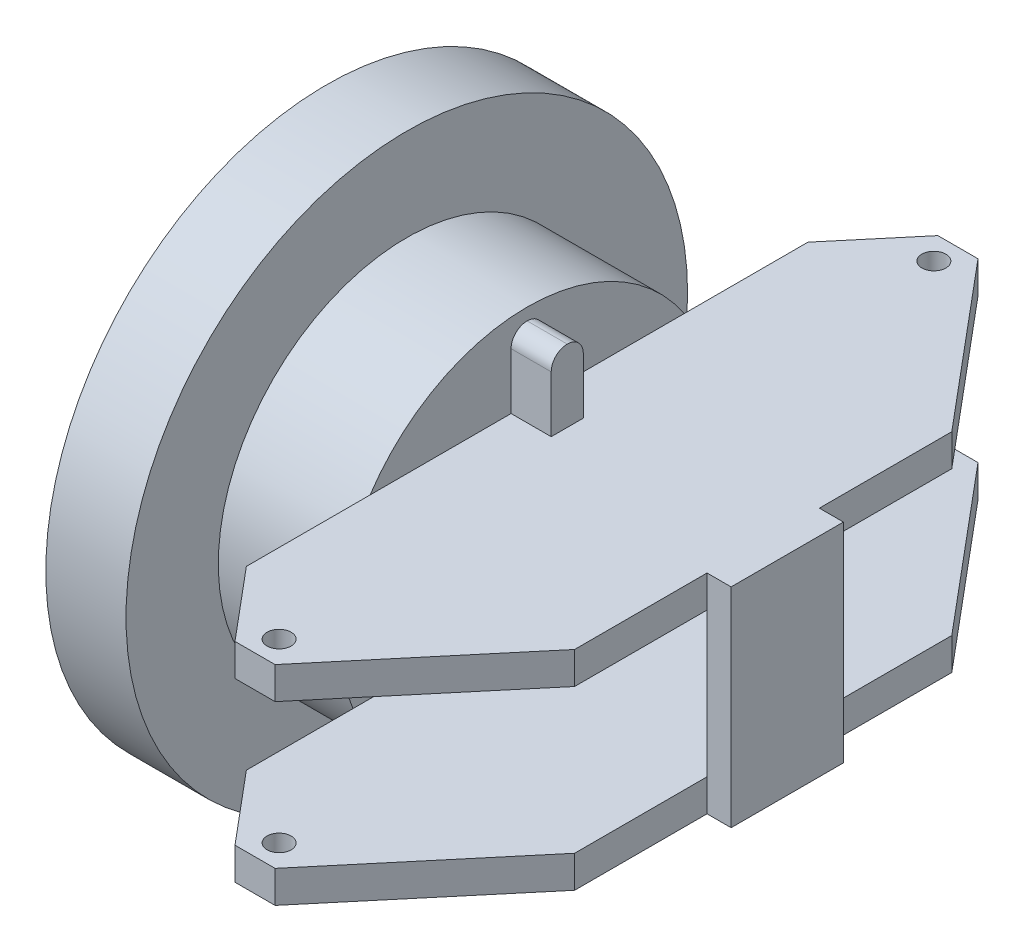
from build123d import *

# Parameters (mm, degrees)
SKETCH1_R               = 35
BOSS_EXTRUDE2_DEPTH     = 10
SKETCH3_R               = 23.5
BOSS_EXTRUDE3_DEPTH     = 15
BOSS_EXTRUDE4_DEPTH     = 4
SKETCH7_R               = 1.5
CUT_EXTRUDE1_DEPTH      = 4
MIRROR2_COPY_1_SKETCH_R = 1.5
MIRROR2_COPY_1_DEPTH    = 4
SKETCH9_W               = 4
SKETCH9_H               = 9
BOSS_EXTRUDE5_DEPTH     = 5
FILLET1_R               = 2
FILLET1_OF_MIRROR3_R    = 2
SKETCH10_W              = 14
SKETCH10_H              = 26
BOSS_EXTRUDE6_DEPTH     = 3
SKETCH11_R              = 10
CUT_EXTRUDE2_DEPTH      = 10


with BuildPart() as part:
    # Sketch1 → Boss-Extrude2 (new body)
    with BuildSketch(Plane(origin=(0, 0, 0), x_dir=(0, 0, -1), z_dir=(1, 0, 0))):
        Circle(SKETCH1_R)
    extrude(amount=BOSS_EXTRUDE2_DEPTH)

    # Sketch3 → Boss-Extrude3 (add)
    with BuildSketch(Plane(origin=(10, 0, 0), x_dir=(0, 0, -1), z_dir=(1, 0, 0))):
        Circle(SKETCH3_R)
    extrude(amount=BOSS_EXTRUDE3_DEPTH)

    # Sketch5 → Boss-Extrude4 (add)
    with BuildSketch(Plane(origin=(0, 13, 0), x_dir=(1, 0, 0), z_dir=(0, 1, 0))):
        Polygon((25, 35), (25, -35), (32.392057511, -43.809511096), (37.392057511, -43.809511096), (54.425929168, -23.509333353), (54.425929168, 23.509333353), (37.392057511, 43.809511096), (32.392057511, 43.809511096), align=None)
    boss_extrude4 = extrude(amount=-BOSS_EXTRUDE4_DEPTH)

    # Sketch7 → Cut-Extrude1 (cut)
    with BuildSketch(Plane(origin=(0, 13, 0), x_dir=(1, 0, 0), z_dir=(0, 1, 0))):
        with Locations(Location((34.892057511, -40.809511096, 0), (0, 0, 270))):
            Circle(SKETCH7_R)
    cut_extrude1 = extrude(amount=-CUT_EXTRUDE1_DEPTH, mode=Mode.SUBTRACT)

    # Mirror1: Cut-Extrude1 across plane
    add(cut_extrude1.mirror(Plane.XY), mode=Mode.SUBTRACT)

    # Mirror2: Boss-Extrude4, Cut-Extrude1 across plane
    add(boss_extrude4.mirror(Plane.ZX))
    add(cut_extrude1.mirror(Plane.ZX), mode=Mode.SUBTRACT)

    # Mirror2 copy 1 sketch → Mirror2 copy 1 (cut)
    with BuildSketch(Plane.XZ.offset(13)):
        with Locations(Location((34.892057511, -40.809511096, 0), (0, 0, 270))):
            Circle(MIRROR2_COPY_1_SKETCH_R)
    extrude(amount=-MIRROR2_COPY_1_DEPTH, mode=Mode.SUBTRACT)

    # Sketch9 → Boss-Extrude5 (add)
    with BuildSketch(Plane(origin=(25, 0, 0), x_dir=(0, 0, -1), z_dir=(1, 0, 0))):
        with Locations((0, 17.5)):
            Rectangle(SKETCH9_W, SKETCH9_H)
    boss_extrude5 = extrude(amount=BOSS_EXTRUDE5_DEPTH)

    # Fillet1
    fillet1_edges = [part.edges().sort_by_distance(p)[0] for p in [
        (27.5, 22, -2),
        (27.5, 22, 2),
    ]]
    fillet(fillet1_edges, radius=FILLET1_R - 0.0001)  # a hair under: the kernel refuses the full size

    # Mirror3: Boss-Extrude5 across plane
    add(boss_extrude5.mirror(Plane.ZX))

    # Fillet1 of Mirror3
    fillet1_of_mirror3_edges = [part.edges().sort_by_distance(p)[0] for p in [
        (27.5, -22, -2),
        (27.5, -22, 2),
    ]]
    fillet(fillet1_of_mirror3_edges, radius=FILLET1_OF_MIRROR3_R - 0.0001)  # a hair under: the kernel refuses the full size

    # Sketch10 → Boss-Extrude6 (add)
    with BuildSketch(Plane(origin=(54.425929168, 0, 0), x_dir=(0, 0, -1), z_dir=(1, 0, 0))):
        Rectangle(SKETCH10_W, SKETCH10_H)
    extrude(amount=BOSS_EXTRUDE6_DEPTH)

    # Sketch11 → Cut-Extrude2 (cut)
    with BuildSketch(Plane.ZY):
        Circle(SKETCH11_R)
    extrude(amount=-CUT_EXTRUDE2_DEPTH, mode=Mode.SUBTRACT)


solid = part.part
